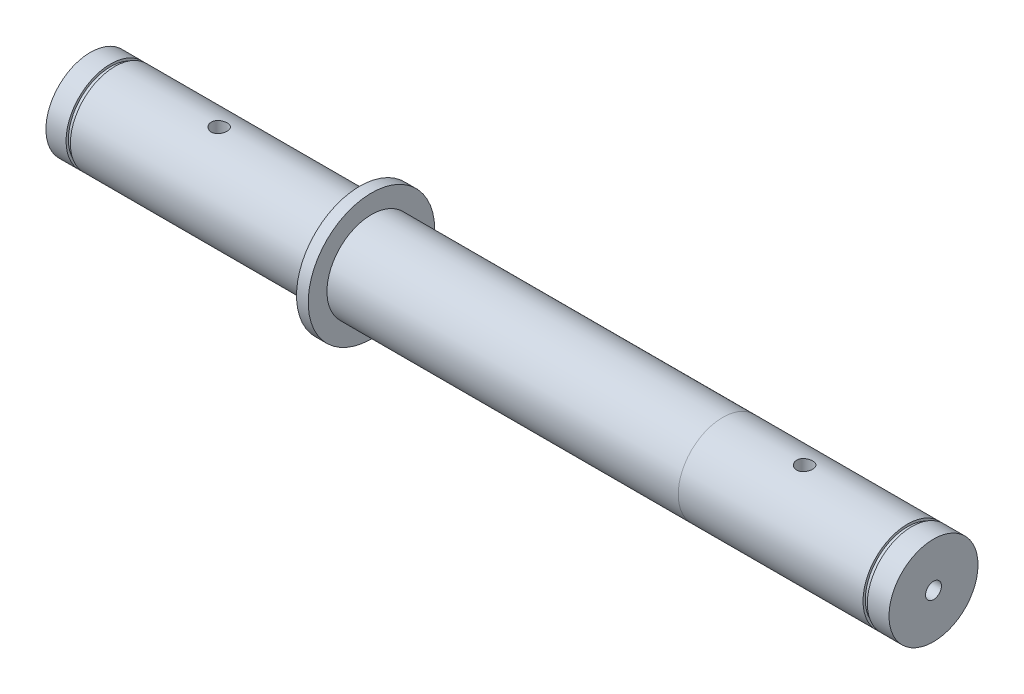
from build123d import *

# Parameters (mm, degrees)
M8_TAPPED_HOLE1_D             = 6.8
M8_TAPPED_HOLE1_DEPTH         = 65
M8_TAPPED_HOLE1_TIP           = 2.042926105
SKIZZE18_W                    = 3.4
SKIZZE18_H                    = 27
M8_GEWINDEBOHRUNG3_AT_2_COUNT = 2
M8_GEWINDEBOHRUNG3_AT_2_PITCH = 250
SPIEGELN2_COPY_1_SKETCH_W     = 3.4
SPIEGELN2_COPY_1_SKETCH_H     = 27
SKIZZE19_W                    = 1.85
SKIZZE19_H                    = 1
SKIZZE20_W                    = 1.85
SKIZZE20_H                    = 1
M8_TAPPED_HOLE2_D             = 6.8
M8_TAPPED_HOLE2_DEPTH         = 65
M8_TAPPED_HOLE2_TIP           = 2.042926105


with BuildPart() as part:
    # Skizze1 → Rotation1 (revolve)
    with BuildSketch(Plane.XY):
        Polygon((180, 19), (180, 0), (-180, 0), (-180, 19), (-65, 19), (-65, 27), (-60, 27), (-60, 19.0001), (90, 19.0001), align=None)
    revolve(axis=Axis((180, 0, 0), (-1, 0, 0)))

    # M8 Tapped Hole1
    with Locations(Plane(origin=(180, 0, 0), x_dir=(0, 0, -1), z_dir=(1, 0, 0))):
        with Locations((0, 0)):
            Hole(M8_TAPPED_HOLE1_D / 2, depth=M8_TAPPED_HOLE1_DEPTH)
            with Locations((0, 0, -(M8_TAPPED_HOLE1_DEPTH + M8_TAPPED_HOLE1_TIP / 2))):  # 118° drill point
                Cone(0, M8_TAPPED_HOLE1_D / 2, M8_TAPPED_HOLE1_TIP, mode=Mode.SUBTRACT)

    # Skizze18 → M8 Gewindebohrung3 (revolve, cut)
    with BuildSketch(Plane(origin=(-125, 0, 0), x_dir=(0, 0, -1), z_dir=(1, 0, 0))):
        with Locations((1.7, 13.5)):
            Rectangle(SKIZZE18_W, SKIZZE18_H)
    m8_gewindebohrung3 = revolve(axis=Axis((-125, -6.35, 0), (0, 1, 0)), mode=Mode.SUBTRACT)

    # M8 Gewindebohrung3 at 2: M8 Gewindebohrung3 ×2
    with Locations(*[(i * M8_GEWINDEBOHRUNG3_AT_2_PITCH, 0, 0) for i in range(1, M8_GEWINDEBOHRUNG3_AT_2_COUNT)]):
        add(m8_gewindebohrung3, mode=Mode.SUBTRACT)

    # Spiegeln2: M8 Gewindebohrung3 across plane
    add(m8_gewindebohrung3.mirror(Plane.ZX), mode=Mode.SUBTRACT)

    # Spiegeln2 copy 1 sketch → Spiegeln2 copy 1 (revolve, cut)
    with BuildSketch(Plane(origin=(125, 0, 0), x_dir=(0, 0, -1), z_dir=(1, 0, 0))):
        with Locations((1.7, -13.5)):
            Rectangle(SPIEGELN2_COPY_1_SKETCH_W, SPIEGELN2_COPY_1_SKETCH_H)
    revolve(axis=Axis((125, 6.35, 0), (0, 1, 0)), mode=Mode.SUBTRACT)

    # Skizze19 → Schnitt-Rotation1 (revolve, cut)
    with BuildSketch(Plane.XY):
        with Locations((169.825, 18.5)):
            Rectangle(SKIZZE19_W, SKIZZE19_H)
    revolve(axis=Axis((-88.99, 0, 0), (1, 0, 0)), mode=Mode.SUBTRACT)

    # Skizze20 → Schnitt-Rotation2 (revolve, cut)
    with BuildSketch(Plane.XY):
        with Locations((-170.475, 18.5)):
            Rectangle(SKIZZE20_W, SKIZZE20_H)
    revolve(axis=Axis((-88.99, 0, 0), (1, 0, 0)), mode=Mode.SUBTRACT)

    # M8 Tapped Hole2
    with Locations(Plane.ZY.offset(180)):
        with Locations((0, 0)):
            Hole(M8_TAPPED_HOLE2_D / 2, depth=M8_TAPPED_HOLE2_DEPTH)
            with Locations((0, 0, -(M8_TAPPED_HOLE2_DEPTH + M8_TAPPED_HOLE2_TIP / 2))):  # 118° drill point
                Cone(0, M8_TAPPED_HOLE2_D / 2, M8_TAPPED_HOLE2_TIP, mode=Mode.SUBTRACT)


solid = part.part
